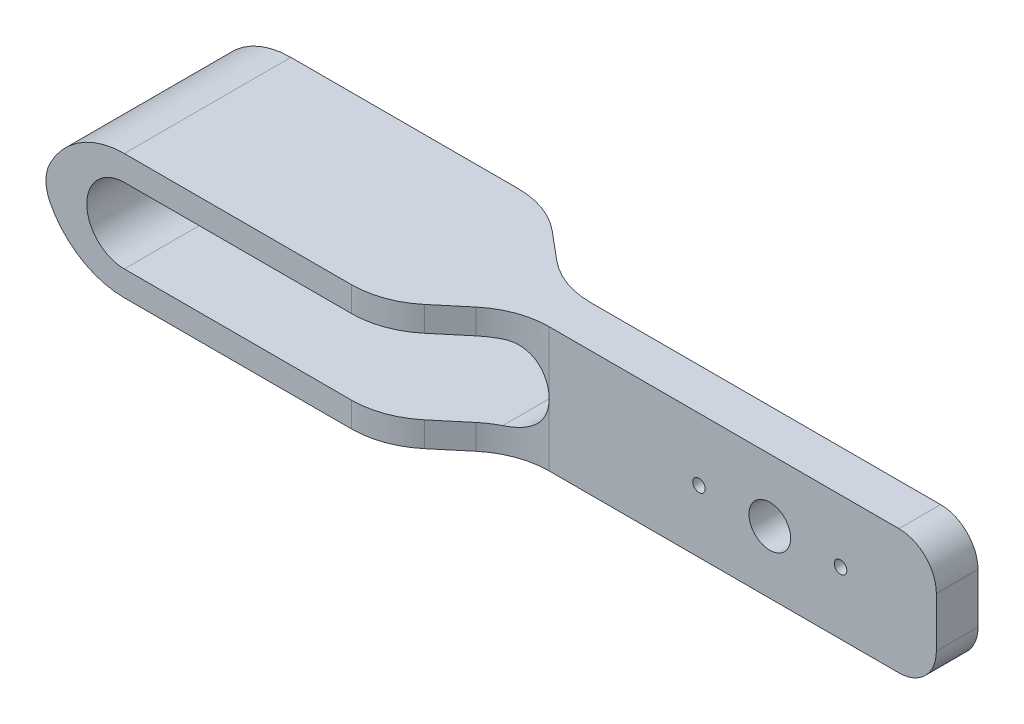
from build123d import *

# Parameters (mm, degrees)
ESBO_O1_W                         = 40
ESBO_O1_H                         = 15
RESSALTO_EXTRUS_O1_DEPTH          = 3
ESBO_O3_W                         = 40
ESBO_O3_H                         = 15
RESSALTO_EXTRUS_O2_DEPTH          = 2
CORTE_EXTRUS_O1_REACH             = 26.418
ESBO_O2_R                         = 2.5
ESBO_O2_R_2                       = 0.75
CORTE_EXTRUS_O1_DIRECTION_2_REACH = 26.418
ESBO_O5_W                         = 20
ESBO_O5_H                         = 15
RESSALTO_EXTRUS_O4_DEPTH          = 60
CHANFRO1_SIZE                     = 19.068057482
CHANFRO1_SIZE_2                   = 16
FILETE4_R                         = 10
CORTE_EXTRUS_O2_DEPTH             = 81.237970309
FILETE5_R                         = 4.5
CIRPATTERN1_COUNT                 = 2
FILLET1_R                         = 4.5


with BuildPart() as part:
    # Esboço1 → Ressalto-extrusão1 (new body)
    with BuildSketch(Plane.XY):
        with Locations((2.5, 1.5)):
            Rectangle(ESBO_O1_W, ESBO_O1_H)
    extrude(amount=-RESSALTO_EXTRUS_O1_DEPTH)

    # Esboço3 → Ressalto-extrusão2 (add)
    with BuildSketch(Plane.XY):
        with Locations((2.5, 1.5)):
            Rectangle(ESBO_O3_W, ESBO_O3_H)
    extrude(amount=RESSALTO_EXTRUS_O2_DEPTH)

    # Corte-extrusão1: up to this face of the body (flat: up to its plane)
    corte_extrus_o1_end = Plane(part.part.faces().sort_by_distance((2.5, 1.5, 2))[0])
    # Esboço2 → Corte-extrusão1 (cut, up to the picked face)
    with BuildSketch(Plane.XY, mode=Mode.PRIVATE) as corte_extrus_o1_sk1:
        with Locations(Location((2.5, 1.5, 0), (0, 0, 180))):
            Circle(ESBO_O2_R)
    corte_extrus_o1_tool1 = split(extrude(corte_extrus_o1_sk1.sketch, amount=CORTE_EXTRUS_O1_REACH, mode=Mode.PRIVATE), bisect_by=corte_extrus_o1_end, keep=Keep.BOTH, mode=Mode.PRIVATE)
    # Esboço2 → Corte-extrusão1 (cut, up to the picked face)
    with BuildSketch(Plane.XY, mode=Mode.PRIVATE) as corte_extrus_o1_sk2:
        with Locations(Location((-6, 1.5, 0), (0, 0, 180))):
            Circle(ESBO_O2_R_2)
    corte_extrus_o1_tool2 = split(extrude(corte_extrus_o1_sk2.sketch, amount=CORTE_EXTRUS_O1_REACH, mode=Mode.PRIVATE), bisect_by=corte_extrus_o1_end, keep=Keep.BOTH, mode=Mode.PRIVATE)
    corte_extrus_o1_1 = corte_extrus_o1_tool1.solids().sort_by(Axis((2.5, 1.5, 0), (0, 0, 1)))[0]
    add(corte_extrus_o1_1, mode=Mode.SUBTRACT)
    corte_extrus_o1_2 = corte_extrus_o1_tool2.solids().sort_by(Axis((-6, 1.5, 0), (0, 0, 1)))[0]
    add(corte_extrus_o1_2, mode=Mode.SUBTRACT)
    corte_extrus_o1 = corte_extrus_o1_1 + corte_extrus_o1_2  # Corte-extrusão1 as one shape, for the pattern or mirror that repeats it

    # Corte-extrusão1 direction 2: up to this face of the body (flat: up to its plane)
    corte_extrus_o1_direction_2_end = Plane(part.part.faces().sort_by_distance((2.5, 1.5, -3))[0])
    # Esboço2 → Corte-extrusão1 direction 2 (cut, up to the picked face)
    with BuildSketch(Plane.XY, mode=Mode.PRIVATE) as corte_extrus_o1_direction_2_sk1:
        with Locations(Location((2.5, 1.5, 0), (0, 0, 180))):
            Circle(ESBO_O2_R)
    corte_extrus_o1_direction_2_tool1 = split(extrude(corte_extrus_o1_direction_2_sk1.sketch, amount=-CORTE_EXTRUS_O1_DIRECTION_2_REACH, mode=Mode.PRIVATE), bisect_by=corte_extrus_o1_direction_2_end, keep=Keep.BOTH, mode=Mode.PRIVATE)
    # Esboço2 → Corte-extrusão1 direction 2 (cut, up to the picked face)
    with BuildSketch(Plane.XY, mode=Mode.PRIVATE) as corte_extrus_o1_direction_2_sk2:
        with Locations(Location((-6, 1.5, 0), (0, 0, 180))):
            Circle(ESBO_O2_R_2)
    corte_extrus_o1_direction_2_tool2 = split(extrude(corte_extrus_o1_direction_2_sk2.sketch, amount=-CORTE_EXTRUS_O1_DIRECTION_2_REACH, mode=Mode.PRIVATE), bisect_by=corte_extrus_o1_direction_2_end, keep=Keep.BOTH, mode=Mode.PRIVATE)
    corte_extrus_o1_direction_2_1 = corte_extrus_o1_direction_2_tool1.solids().sort_by(Axis((2.5, 1.5, 0), (0, 0, -1)))[0]
    add(corte_extrus_o1_direction_2_1, mode=Mode.SUBTRACT)
    corte_extrus_o1_direction_2_2 = corte_extrus_o1_direction_2_tool2.solids().sort_by(Axis((-6, 1.5, 0), (0, 0, -1)))[0]
    add(corte_extrus_o1_direction_2_2, mode=Mode.SUBTRACT)
    corte_extrus_o1_direction_2 = corte_extrus_o1_direction_2_1 + corte_extrus_o1_direction_2_2  # Corte-extrusão1 direction 2 as one shape, for the pattern or mirror that repeats it

    # Esboço5 → Ressalto-extrusão4 (add)
    with BuildSketch(Plane.ZY.offset(17.5)):
        with Locations((-0.5, 1.5)):
            Rectangle(ESBO_O5_W, ESBO_O5_H)
    extrude(amount=RESSALTO_EXTRUS_O4_DEPTH)

    # Chanfro1
    # the kernel refuses this chamfer: 19.068057482, 16 mm, written as the material it takes off along each edge
    with BuildSketch(Plane(origin=(-17.5, -55.146127732, 9.5), x_dir=(-0.9996889667359941, 0, 0.024939322090234247), z_dir=(0, 1, 0))) as chanfro1_piece_1_section:
        Polygon((CHANFRO1_SIZE * 0.99968896671, -CHANFRO1_SIZE * 0.0249393220896), (-CHANFRO1_SIZE_2 * 0.0249393220902, -CHANFRO1_SIZE_2 * 0.999688966736), (0, 0), align=None)
    chanfro1_piece_1 = extrude(amount=113.292255464, mode=Mode.PRIVATE)
    chanfro1_piece_1 = split(chanfro1_piece_1, bisect_by=Plane(origin=(-25.155035178, 1.5, 2), z_dir=(0, 0, 1)), keep=Keep.TOP, mode=Mode.PRIVATE)
    add(chanfro1_piece_1, mode=Mode.SUBTRACT)
    with BuildSketch(Plane(origin=(-17.5, -55.146127732, 9.5), x_dir=(-0.9996889667359941, 0, 0.024939322090234247), z_dir=(0, 1, 0))) as chanfro1_piece_2_section:
        Polygon((CHANFRO1_SIZE * 0.99968896671, -CHANFRO1_SIZE * 0.0249393220896), (-CHANFRO1_SIZE_2 * 0.0249393220902, -CHANFRO1_SIZE_2 * 0.999688966736), (0, 0), align=None)
    chanfro1_piece_2 = extrude(amount=113.292255464, mode=Mode.PRIVATE)
    chanfro1_piece_2 = split(chanfro1_piece_2, bisect_by=Plane(origin=(-18.373305927, 1.5, -3), z_dir=(0, 0, -1)), keep=Keep.TOP, mode=Mode.PRIVATE)
    add(chanfro1_piece_2, mode=Mode.SUBTRACT)
    with BuildSketch(Plane(origin=(-17.5, 58.146127732, -10.5), x_dir=(-0.9996889667359941, 0, -0.02493932209023425), z_dir=(0, -1, 0))) as chanfro1_piece_3_section:
        Polygon((CHANFRO1_SIZE * 0.99968896671, -CHANFRO1_SIZE * 0.0249393220896), (-CHANFRO1_SIZE_2 * 0.0249393220902, -CHANFRO1_SIZE_2 * 0.999688966736), (0, 0), align=None)
    chanfro1_piece_3 = extrude(amount=113.292255464, mode=Mode.PRIVATE)
    chanfro1_piece_3 = split(chanfro1_piece_3, bisect_by=Plane(origin=(-25.155035178, 1.5, -3), z_dir=(0, 0, -1)), keep=Keep.TOP, mode=Mode.PRIVATE)
    add(chanfro1_piece_3, mode=Mode.SUBTRACT)
    with BuildSketch(Plane(origin=(-17.5, 58.146127732, -10.5), x_dir=(-0.9996889667359941, 0, -0.02493932209023425), z_dir=(0, -1, 0))) as chanfro1_piece_4_section:
        Polygon((CHANFRO1_SIZE * 0.99968896671, -CHANFRO1_SIZE * 0.0249393220896), (-CHANFRO1_SIZE_2 * 0.0249393220902, -CHANFRO1_SIZE_2 * 0.999688966736), (0, 0), align=None)
    chanfro1_piece_4 = extrude(amount=113.292255464, mode=Mode.PRIVATE)
    chanfro1_piece_4 = split(chanfro1_piece_4, bisect_by=Plane(origin=(-18.373305927, 1.5, 2), z_dir=(0, 0, 1)), keep=Keep.TOP, mode=Mode.PRIVATE)
    add(chanfro1_piece_4, mode=Mode.SUBTRACT)

    # Filete4
    # the kernel refuses this fillet: 10 mm, written as the material it adds along each edge
    with BuildSketch(Plane(origin=(-27.629905537, -6, 2), x_dir=(1, 0, 0), z_dir=(0, 1, 0)), Plane(origin=(-27.629905537, 9, -3), x_dir=(1, 0, 0), z_dir=(0, -1, 0))) as filete4_piece_1:
        with BuildLine():
            CenterArc((FILETE4_R * 0.363970234266, -FILETE4_R), FILETE4_R, 90, 40)
            Line((-FILETE4_R * 0.27881737542, -FILETE4_R * 0.233955556881), (0, 0))
            Line((0, 0), (FILETE4_R * 0.363970234266, 0))
        make_face()
    extrude(amount=15)
    # the kernel refuses this fillet: 10 mm, written as the material it takes off along each edge
    with BuildSketch(Plane(origin=(-36.568057482, -15.099255857, 9.5), x_dir=(-1, 0, 0), z_dir=(0, 1, 0))) as filete4_2_piece_1:
        with BuildLine():
            CenterArc((FILETE4_R * 0.363970234266, -FILETE4_R), FILETE4_R, 90, 40)
            Line((-FILETE4_R * 0.27881737542, -FILETE4_R * 0.233955556881), (0, 0))
            Line((0, 0), (FILETE4_R * 0.363970234266, 0))
        make_face()
    extrude(amount=33.198511713, mode=Mode.SUBTRACT)
    with BuildSketch(Plane(origin=(-77.5, 9, 34.5), x_dir=(0, -1, 0), z_dir=(0, 0, -1))) as filete4_2_piece_2:
        with BuildLine():
            CenterArc((FILETE4_R, -FILETE4_R), FILETE4_R, 90, 90)
            Line((0, -FILETE4_R), (0, 0))
            Line((0, 0), (FILETE4_R, 0))
        make_face()
    extrude(amount=70, mode=Mode.SUBTRACT)
    with BuildSketch(Plane(origin=(-77.5, -6, -35.5), x_dir=(1, 0, 0), z_dir=(0, 0, 1))) as filete4_2_piece_3:
        with BuildLine():
            CenterArc((FILETE4_R, FILETE4_R), FILETE4_R, 180, 90)
            Line((0, FILETE4_R), (0, 0))
            Line((0, 0), (FILETE4_R, 0))
        make_face()
    extrude(amount=70, mode=Mode.SUBTRACT)
    with BuildSketch(Plane(origin=(-36.568057482, 18.099255857, -10.5), x_dir=(0.7660444431190706, 0, 0.6427876096864291), z_dir=(0, -1, 0))) as filete4_2_piece_4:
        with BuildLine():
            CenterArc((FILETE4_R * 0.363970234266, FILETE4_R), FILETE4_R, 230, 40)
            Line((-FILETE4_R * 0.27881737542, FILETE4_R * 0.233955556881), (0, 0))
            Line((0, 0), (FILETE4_R * 0.363970234266, 0))
        make_face()
    extrude(amount=33.198511713, mode=Mode.SUBTRACT)

    # Esboço6 → Corte-extrusão2 (cut, through all)
    with BuildSketch(Plane.XY.offset(9.5)):
        with BuildLine():
            Line((-43.207759824, 6), (-67.5, 6))
            ThreePointArc((-67.5, 6), (-71.468626967, 4.766281297), (-74.038348415, 1.5))
            ThreePointArc((-74.038348415, 1.5), (-71.468626967, -1.766281297), (-67.5, -3))
            Line((-67.5, -3), (-43.207759824, -3))
            Line((-43.207759824, -3), (-23.990203194, -3))
            Line((-23.990203194, -3), (-23.990203194, 6))
            Line((-23.990203194, 6), (-43.207759824, 6))
        make_face()
    extrude(amount=-CORTE_EXTRUS_O2_DEPTH, mode=Mode.SUBTRACT)

    # Filete5
    # the kernel refuses this fillet: 4.5 mm, written as the material it adds along each edge
    with BuildSketch(Plane(origin=(-23.990203194, 6, 13.25), x_dir=(0, -1, 0), z_dir=(0, 0, -1))) as filete5_piece_1_section:
        with BuildLine():
            CenterArc((FILETE5_R, FILETE5_R), FILETE5_R, 180, 90)
            Line((0, FILETE5_R), (0, 0))
            Line((0, 0), (FILETE5_R, 0))
        make_face()
    filete5_piece_1 = extrude(amount=27.5, mode=Mode.PRIVATE)
    filete5_piece_1 = filete5_piece_1 - Plane(origin=(-23.990203194, 5.729138272, 12), x_dir=(1, 0, 0), z_dir=(0, -1, 0)) * Cylinder(10, 73, mode=Mode.PRIVATE)
    filete5_piece_1 = filete5_piece_1 - Plane(origin=(-23.990203194, 5.729138272, -13), x_dir=(1, 0, 0), z_dir=(0, 1, 0)) * Cylinder(10, 73, mode=Mode.PRIVATE)
    add(filete5_piece_1)
    with BuildSketch(Plane(origin=(-23.990203194, -3, 13.25), x_dir=(-1, 0, 0), z_dir=(0, 0, -1))) as filete5_piece_2_section:
        with BuildLine():
            CenterArc((FILETE5_R, FILETE5_R), FILETE5_R, 180, 90)
            Line((0, FILETE5_R), (0, 0))
            Line((0, 0), (FILETE5_R, 0))
        make_face()
    filete5_piece_2 = extrude(amount=27.5, mode=Mode.PRIVATE)
    filete5_piece_2 = filete5_piece_2 - Plane(origin=(-23.990203194, -2.729138204, 12), x_dir=(1, 0, 0), z_dir=(0, -1, 0)) * Cylinder(10, 73, mode=Mode.PRIVATE)
    filete5_piece_2 = filete5_piece_2 - Plane(origin=(-23.990203194, -2.729138204, -13), x_dir=(1, 0, 0), z_dir=(0, 1, 0)) * Cylinder(10, 73, mode=Mode.PRIVATE)
    add(filete5_piece_2)
    # the kernel refuses this fillet: 4.5 mm, written as the material it takes off along each edge
    with BuildSketch(Plane(origin=(22.5, 9, -14.25), x_dir=(0, -1, 0), z_dir=(0, 0, 1))) as filete5_2_piece_1:
        with BuildLine():
            CenterArc((FILETE5_R, -FILETE5_R), FILETE5_R, 90, 90)
            Line((0, -FILETE5_R), (0, 0))
            Line((0, 0), (FILETE5_R, 0))
        make_face()
    extrude(amount=27.5, mode=Mode.SUBTRACT)
    with BuildSketch(Plane(origin=(22.5, -6, -14.25), x_dir=(0, 1, 0), z_dir=(0, 0, 1))) as filete5_2_piece_2:
        with BuildLine():
            CenterArc((FILETE5_R, FILETE5_R), FILETE5_R, 180, 90)
            Line((0, FILETE5_R), (0, 0))
            Line((0, 0), (FILETE5_R, 0))
        make_face()
    extrude(amount=27.5, mode=Mode.SUBTRACT)

    # CirPattern1: Corte-extrusão1, Corte-extrusão1 direction 2 ×2 about axis
    cirpattern1_axis = Axis((2.5, 1.5, 0), (0, 0, 1))
    add([corte_extrus_o1.rotate(cirpattern1_axis, i * 360 / CIRPATTERN1_COUNT) for i in range(1, CIRPATTERN1_COUNT)], mode=Mode.SUBTRACT)
    add([corte_extrus_o1_direction_2.rotate(cirpattern1_axis, i * 360 / CIRPATTERN1_COUNT) for i in range(1, CIRPATTERN1_COUNT)], mode=Mode.SUBTRACT)

    # Fillet1
    # the kernel refuses this fillet: 4.5 mm, written as the material it adds along each edge
    with BuildSketch(Plane(origin=(-74.038348415, 1.5, 9.5), x_dir=(0.8237540047591835, -0.5669473870150624, 0), z_dir=(0, 0, -1))) as fillet1_piece_1:
        with BuildLine():
            CenterArc((5.385987304, -3.706897218), FILLET1_R, 55.462463337, 179.999811507)
            ThreePointArc((2.834717965, -7.413786043), (0.265006632, -4.147503783), (0, 0))
            ThreePointArc((0, 0), (3.968622224, 1.233715439), (7.937244448, 0))
        make_face()
    extrude(amount=20)
    # the kernel refuses this fillet: 4.5 mm, written as the material it takes off along each edge
    with BuildSketch(Plane(origin=(-77.182458366, 1.5, -15.968577797), x_dir=(0.3543987879296291, -0.9350943797895536, 0), z_dir=(0, 0, 1))) as fillet1_2_piece_1:
        with BuildLine():
            CenterArc((1.695259117, 4.473004216), FILLET1_R, 222.207706223, 54.071383579)
            ThreePointArc((-1.63795498, 1.449813223), (-0.858738838, 0.679985448), (0, 0))
            ThreePointArc((0, 0), (1.093715559, -0.05999063), (2.187431119, 0))
        make_face()
    extrude(amount=30.937155594, mode=Mode.SUBTRACT)


solid = part.part
